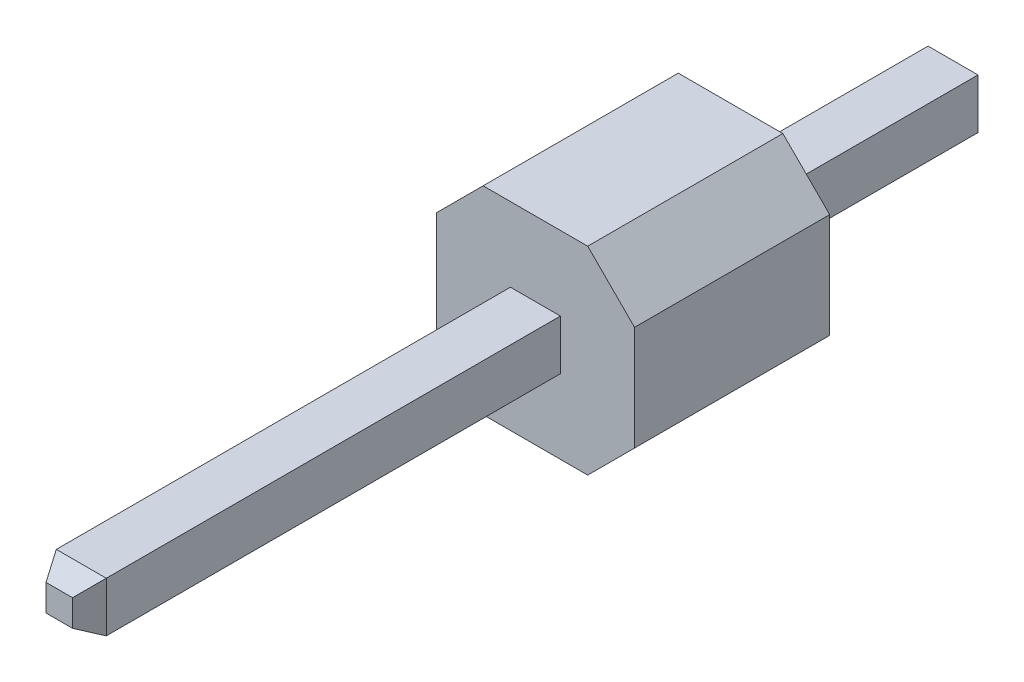
from build123d import *
from OCP.BRepFilletAPI import BRepFilletAPI_MakeChamfer

# Parameters (mm, degrees)
SKETCH_1_W           = 2.54
SKETCH_1_H           = 2.54
EXTRUDE_1_DEPTH      = 2.5
CHAMFER_1_SIZE       = 0.6
EXTRUDE_2_DEPTH      = 3
EXTRUDE_2_DEPTH_BACK = 8.6
SKETCH_2_W           = 0.64
SKETCH_2_H           = 0.64
CHAMFER_2_SIZE       = 0.15
CHAMFER_2_SIZE2      = 0.28210897


with BuildPart() as part:
    # Эскиз1 → Бобышка-Вытянуть1 (new body)
    with BuildSketch(Plane.XY):
        Rectangle(SKETCH_1_W, SKETCH_1_H)
    extrude(amount=EXTRUDE_1_DEPTH)

    # Фаска1
    chamfer_1_edges = [part.edges().sort_by_distance(p)[0] for p in [
        (-1.27, 1.27, 1.25),
        (-1.27, -1.27, 1.25),
        (1.27, -1.27, 1.25),
        (1.27, 1.27, 1.25),
    ]]
    chamfer(chamfer_1_edges, length=CHAMFER_1_SIZE)

    # Эскиз2 → Бобышка-Вытянуть2 (add, two sides: drawn at the far end of the back side and taken through both)
    with BuildSketch(Plane(origin=(0, 0, 0), x_dir=(-1, 0, 0), z_dir=(0, 0, -1)).offset(-EXTRUDE_2_DEPTH_BACK)):
        Rectangle(SKETCH_2_W, SKETCH_2_H)
    extrude(amount=EXTRUDE_2_DEPTH + EXTRUDE_2_DEPTH_BACK)

    # Фаска2: one chamfer whose edges measure the first distance from different faces: ONE call of the kernel's chamfer builder (chamfer() names one face for all edges)
    chamfer_2_edges_1 = [part.edges().sort_by_distance(p)[0] for p in [
        (-0.32, 0, -3),
    ]]
    chamfer_2_side_1 = [part.faces().sort_by_distance(p)[0] for p in [
        (-0.32, 0, -1.5),
    ]]
    chamfer_2_edges_2 = [part.edges().sort_by_distance(p)[0] for p in [
        (0, 0.32, -3),
    ]]
    chamfer_2_side_2 = [part.faces().sort_by_distance(p)[0] for p in [
        (0, 0.32, -1.5),
    ]]
    chamfer_2_edges_3 = [part.edges().sort_by_distance(p)[0] for p in [
        (0.32, 0, -3),
    ]]
    chamfer_2_side_3 = [part.faces().sort_by_distance(p)[0] for p in [
        (0.32, 0, -1.5),
    ]]
    chamfer_2_edges_4 = [part.edges().sort_by_distance(p)[0] for p in [
        (0, -0.32, -3),
    ]]
    chamfer_2_side_4 = [part.faces().sort_by_distance(p)[0] for p in [
        (0, -0.32, -1.5),
    ]]
    chamfer_2_edges_5 = [part.edges().sort_by_distance(p)[0] for p in [
        (0, 0.32, 8.6),
        (0.32, 0, 8.6),
        (0, -0.32, 8.6),
        (-0.32, 0, 8.6),
    ]]
    chamfer_2_side_5 = [part.faces().sort_by_distance(p)[0] for p in [
        (0, 0, 8.6),
    ]]
    chamfer_2 = BRepFilletAPI_MakeChamfer(part.part.solid().wrapped)
    for e in chamfer_2_edges_1:
        chamfer_2.Add(CHAMFER_2_SIZE, CHAMFER_2_SIZE2, e.wrapped, chamfer_2_side_1[0].wrapped)  # the first distance lies on this face
    for e in chamfer_2_edges_2:
        chamfer_2.Add(CHAMFER_2_SIZE, CHAMFER_2_SIZE2, e.wrapped, chamfer_2_side_2[0].wrapped)  # the first distance lies on this face
    for e in chamfer_2_edges_3:
        chamfer_2.Add(CHAMFER_2_SIZE, CHAMFER_2_SIZE2, e.wrapped, chamfer_2_side_3[0].wrapped)  # the first distance lies on this face
    for e in chamfer_2_edges_4:
        chamfer_2.Add(CHAMFER_2_SIZE, CHAMFER_2_SIZE2, e.wrapped, chamfer_2_side_4[0].wrapped)  # the first distance lies on this face
    for e in chamfer_2_edges_5:
        chamfer_2.Add(CHAMFER_2_SIZE, CHAMFER_2_SIZE2, e.wrapped, chamfer_2_side_5[0].wrapped)  # the first distance lies on this face
    add(Compound.cast(chamfer_2.Shape()), mode=Mode.REPLACE)


solid = part.part
